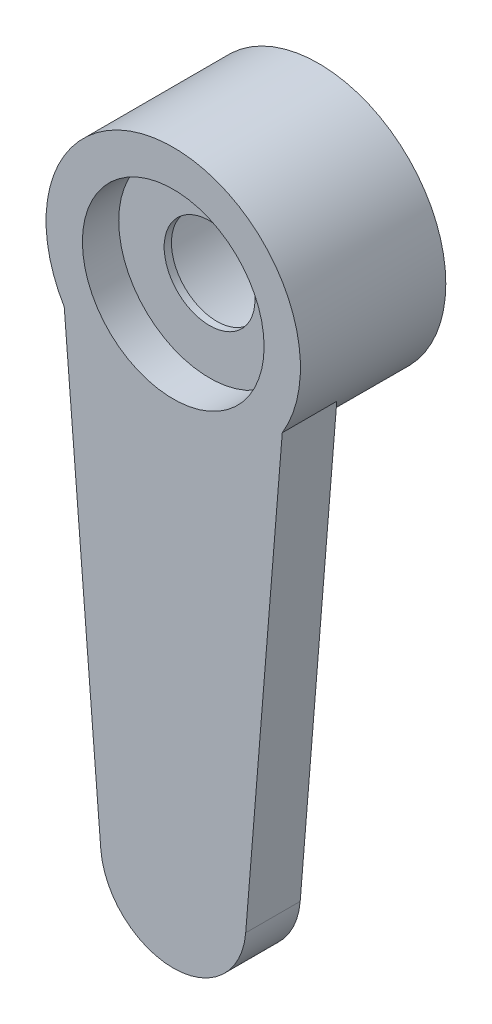
from build123d import *

# Parameters (mm, degrees)
SKETCH1_R           = 3.5
SKETCH1_R_2         = 2.5
BOSS_EXTRUDE1_DEPTH = 2.8
SKETCH2_R           = 3.5
SKETCH2_R_2         = 1.25
BOSS_EXTRUDE2_DEPTH = 0.2
SKETCH3_R           = 3.5
SKETCH3_R_2         = 2.5
BOSS_EXTRUDE3_DEPTH = 1
BOSS_EXTRUDE4_START = -1.5
BOSS_EXTRUDE4_DEPTH = 1.5


with BuildPart() as part:
    # Sketch1 → Boss-Extrude1 (new body)
    with BuildSketch(Plane.XY):
        Circle(SKETCH1_R)
        Circle(SKETCH1_R_2, mode=Mode.SUBTRACT)
    extrude(amount=BOSS_EXTRUDE1_DEPTH)

    # Sketch2 → Boss-Extrude2 (add)
    with BuildSketch(Plane.XY.offset(2.8)):
        Circle(SKETCH2_R)
        Circle(SKETCH2_R_2, mode=Mode.SUBTRACT)
    extrude(amount=BOSS_EXTRUDE2_DEPTH)

    # Sketch3 → Boss-Extrude3 (add)
    with BuildSketch(Plane.XY.offset(3)):
        Circle(SKETCH3_R)
        Circle(SKETCH3_R_2, mode=Mode.SUBTRACT)
    extrude(amount=BOSS_EXTRUDE3_DEPTH)

    # Sketch4 → Boss-Extrude4 (add)
    with BuildSketch(Plane.XY.offset(4).offset(BOSS_EXTRUDE4_START)):
        with BuildLine():
            Line((-3, -1.802775638), (-1.993465051, -14.223343039))
            ThreePointArc((-1.993465051, -14.223343039), (0, -16.061797098), (1.993465051, -14.223343039))
            Line((1.993465051, -14.223343039), (3, -1.802775638))
            ThreePointArc((3, -1.802775638), (0, -3.5), (-3, -1.802775638))
        make_face()
    extrude(amount=BOSS_EXTRUDE4_DEPTH)


solid = part.part
